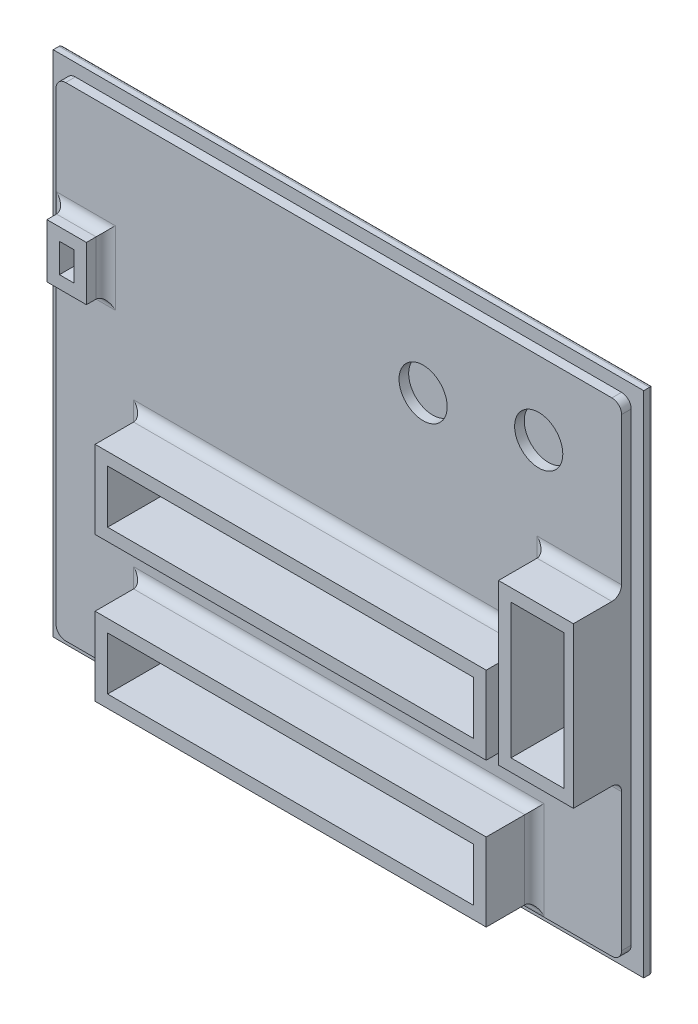
from build123d import *

# Parameters (mm, degrees)
OUTSIDE_DIM_W                         = 61.3
OUTSIDE_DIM_H                         = 52.8
DODANIE_WYCI_GNI_CIE1_DEPTH           = 1
INSIDE_DIM_W                          = 58.7
INSIDE_DIM_H                          = 50.2
DODANIE_WYCI_GNI_CIE2_DEPTH           = 1
CAPACITORS_R                          = 2.5
CAPACITORS_CUTOUT_DEPTH               = 1
RESET_BUTTON_W                        = 4.1
RESET_BUTTON_H                        = 5.6
RESET_BUTTON_SHIELD_DEPTH             = 2
RESET_BUTTON_CUTOUT_DEPTH             = 41.501635769
RESET_BUTTON_CUTOUT_DEPTH_BACK        = 41.501635769
SZKIC5_3_W                            = 1.5
SZKIC5_3_H                            = 3
SWDIO_W                               = 7.775
SWDIO_H                               = 16.6
SWDIO_SHIELD_DEPTH                    = 5
SWDIO_CUTOUT_DEPTH                    = 41.760060108
SWDIO_CUTOUT_DEPTH_BACK               = 41.760060108
SZKIC6_3_W                            = 5.5
SZKIC6_3_H                            = 14
ART_SKIN_CONNECTORS_W                 = 40.6
ART_SKIN_CONNECTORS_H                 = 8.1
ART_SKIN_CONNECTORS_W_2               = 38
ART_SKIN_CONNECTORS_H_2               = 5.5
ART_SKIN_CONNECTORS_SHIELD_DEPTH      = 5
ART_SKIN_CONNECTORS_CUTOUT_DEPTH      = 41.760060108
ART_SKIN_CONNECTORS_CUTOUT_DEPTH_BACK = 41.760060108
SZKIC7_2_W                            = 38
SZKIC7_2_H                            = 5.5
BOTTOM_OF_PRINT_CURVE_R               = 0.4
SIDE_MOUNT_SURVE_R                    = 1
CURVE_ALL_SHIELDS_R                   = 1


with BuildPart() as part:
    # Outside dim → Dodanie-wyciągnięcie1 (new body)
    with BuildSketch(Plane.XY):
        Rectangle(OUTSIDE_DIM_W, OUTSIDE_DIM_H)
    extrude(amount=-DODANIE_WYCI_GNI_CIE1_DEPTH)

    # Inside dim → Dodanie-wyciągnięcie2 (add)
    with BuildSketch(Plane.XY):
        Rectangle(INSIDE_DIM_W, INSIDE_DIM_H)
    extrude(amount=DODANIE_WYCI_GNI_CIE2_DEPTH)

    # Capacitors → Capacitors cutout (cut)
    with BuildSketch(Plane.XY.offset(1)):
        with Locations((8.75, 15.75)):
            Circle(CAPACITORS_R)
        with Locations((20.75, 17.5)):
            Circle(CAPACITORS_R)
    extrude(amount=-CAPACITORS_CUTOUT_DEPTH, mode=Mode.SUBTRACT)

    # Reset button → Reset button shield (add)
    with BuildSketch(Plane.XY.offset(1)):
        with Locations((-26.25, 11)):
            Rectangle(RESET_BUTTON_W, RESET_BUTTON_H)
    extrude(amount=RESET_BUTTON_SHIELD_DEPTH)

    # Szkic5<3> → Reset button cutout (cut, two sides: drawn at the far end of the back side and taken through both)
    with BuildSketch(Plane.XY.offset(1).offset(-RESET_BUTTON_CUTOUT_DEPTH_BACK)):
        with Locations((-26.25, 11)):
            Rectangle(SZKIC5_3_W, SZKIC5_3_H)
    extrude(amount=RESET_BUTTON_CUTOUT_DEPTH + RESET_BUTTON_CUTOUT_DEPTH_BACK, mode=Mode.SUBTRACT)

    # SWDIO → SWDIO shield (add)
    with BuildSketch(Plane.XY.offset(1)):
        with Locations((25.4625, -0.5)):
            Rectangle(SWDIO_W, SWDIO_H)
    extrude(amount=SWDIO_SHIELD_DEPTH)

    # Szkic6<3> → SWDIO cutout (cut, two sides: drawn at the far end of the back side and taken through both)
    with BuildSketch(Plane.XY.offset(1).offset(-SWDIO_CUTOUT_DEPTH_BACK)):
        with Locations((25.625, -0.5)):
            Rectangle(SZKIC6_3_W, SZKIC6_3_H)
    extrude(amount=SWDIO_CUTOUT_DEPTH + SWDIO_CUTOUT_DEPTH_BACK, mode=Mode.SUBTRACT)

    # Art skin connectors → Art skin connectors shield (add)
    # profile 1 of 2: a face of its own
    with BuildSketch(Plane.XY.offset(1)):
        with Locations((0, -19.95)):
            Rectangle(ART_SKIN_CONNECTORS_W, ART_SKIN_CONNECTORS_H)
        with Locations((0, -19.95)):
            Rectangle(ART_SKIN_CONNECTORS_W_2, ART_SKIN_CONNECTORS_H_2, mode=Mode.SUBTRACT)
    # profile 2 of 2: a face of its own
    with BuildSketch(Plane.XY.offset(1)):
        with Locations((0, -4.95)):
            Rectangle(ART_SKIN_CONNECTORS_W, ART_SKIN_CONNECTORS_H)
        with Locations((0, -4.95)):
            Rectangle(ART_SKIN_CONNECTORS_W_2, ART_SKIN_CONNECTORS_H_2, mode=Mode.SUBTRACT)
    extrude(amount=ART_SKIN_CONNECTORS_SHIELD_DEPTH)

    # Szkic7<2> → Art skin connectors cutout (cut, two sides: drawn at the far end of the back side and taken through both)
    with BuildSketch(Plane.XY.offset(1).offset(-ART_SKIN_CONNECTORS_CUTOUT_DEPTH_BACK)):
        with Locations((0, -4.95)):
            Rectangle(SZKIC7_2_W, SZKIC7_2_H)
        with Locations((0, -19.95)):
            Rectangle(SZKIC7_2_W, SZKIC7_2_H)
    extrude(amount=ART_SKIN_CONNECTORS_CUTOUT_DEPTH + ART_SKIN_CONNECTORS_CUTOUT_DEPTH_BACK, mode=Mode.SUBTRACT)

    # Bottom of print curve
    bottom_of_print_curve_edges = [part.edges().sort_by_distance(p)[0] for p in [
        (30.65, 0, -1),
        (0, -22.7, -1),
        (-19, -19.95, -1),
        (0, -17.2, -1),
        (19, -19.95, -1),
        (-19, -4.95, -1),
        (0, -7.7, -1),
        (0, -2.2, -1),
        (19, -4.95, -1),
        (0, 26.4, -1),
        (-30.65, 0, -1),
        (-27, 11, -1),
        (-26.25, 12.5, -1),
        (-25.5, 11, -1),
        (-26.25, 9.5, -1),
        (22.875, -0.5, -1),
        (25.625, -7.5, -1),
        (25.625, 6.5, -1),
        (28.375, -0.5, -1),
        (0, -26.4, -1),
    ]]
    fillet(bottom_of_print_curve_edges, radius=BOTTOM_OF_PRINT_CURVE_R)

    # Side mount surve
    side_mount_surve_edges = [part.edges().sort_by_distance(p)[0] for p in [
        (-29.35, 25.1, 0.5),
        (-29.35, -25.1, 0.5),
        (29.35, -25.1, 0.5),
        (29.35, 25.1, 0.5),
    ]]
    fillet(side_mount_surve_edges, radius=SIDE_MOUNT_SURVE_R)

    # Curve all shields
    # the kernel refuses this fillet: 1 mm, written as the material it adds along each edge
    with BuildSketch(Plane(origin=(-20.3, -24, 1), x_dir=(-1, 0, 0), z_dir=(0, 1, 0)), Plane(origin=(20.3, -0.9, 1), x_dir=(1, 0, 0), z_dir=(0, -1, 0)), Plane(origin=(-20.3, -9, 1), x_dir=(-1, 0, 0), z_dir=(0, 1, 0)), Plane(origin=(20.3, -15.9, 1), x_dir=(1, 0, 0), z_dir=(0, -1, 0))) as curve_all_shields_piece_1:
        with BuildLine():
            CenterArc((CURVE_ALL_SHIELDS_R, CURVE_ALL_SHIELDS_R), CURVE_ALL_SHIELDS_R, 180, 90)
            Line((0, CURVE_ALL_SHIELDS_R), (0, 0))
            Line((0, 0), (CURVE_ALL_SHIELDS_R, 0))
        make_face()
    extrude(amount=8.1)
    with BuildSketch(Plane(origin=(-20.3, -0.9, 1), x_dir=(0, 1, 0), z_dir=(1, 0, 0)), Plane(origin=(20.3, -9, 1), x_dir=(0, -1, 0), z_dir=(-1, 0, 0)), Plane(origin=(-20.3, -15.9, 1), x_dir=(0, 1, 0), z_dir=(1, 0, 0)), Plane(origin=(20.3, -24, 1), x_dir=(0, -1, 0), z_dir=(-1, 0, 0))) as curve_all_shields_piece_2:
        with BuildLine():
            CenterArc((CURVE_ALL_SHIELDS_R, CURVE_ALL_SHIELDS_R), CURVE_ALL_SHIELDS_R, 180, 90)
            Line((0, CURVE_ALL_SHIELDS_R), (0, 0))
            Line((0, 0), (CURVE_ALL_SHIELDS_R, 0))
        make_face()
    extrude(amount=40.6)
    with BuildSketch(Plane(origin=(-24.2, 13.8, 1), x_dir=(0, 1, 0), z_dir=(-1, 0, 0)), Plane(origin=(-28.3, 8.2, 1), x_dir=(0, -1, 0), z_dir=(1, 0, 0))) as curve_all_shields_piece_3:
        with BuildLine():
            CenterArc((CURVE_ALL_SHIELDS_R, -CURVE_ALL_SHIELDS_R), CURVE_ALL_SHIELDS_R, 90, 90)
            Line((0, -CURVE_ALL_SHIELDS_R), (0, 0))
            Line((0, 0), (CURVE_ALL_SHIELDS_R, 0))
        make_face()
    extrude(amount=4.1)
    with BuildSketch(Plane(origin=(-28.3, 13.8, 1), x_dir=(-1, 0, 0), z_dir=(0, -1, 0)), Plane(origin=(-24.2, 8.2, 1), x_dir=(1, 0, 0), z_dir=(0, 1, 0))) as curve_all_shields_piece_4:
        with BuildLine():
            CenterArc((CURVE_ALL_SHIELDS_R, -CURVE_ALL_SHIELDS_R), CURVE_ALL_SHIELDS_R, 90, 90)
            Line((0, -CURVE_ALL_SHIELDS_R), (0, 0))
            Line((0, 0), (CURVE_ALL_SHIELDS_R, 0))
        make_face()
    extrude(amount=5.6)
    with BuildSketch(Plane(origin=(21.575, -8.8, 1), x_dir=(-1, 0, 0), z_dir=(0, 1, 0))) as curve_all_shields_piece_5:
        with BuildLine():
            CenterArc((CURVE_ALL_SHIELDS_R, CURVE_ALL_SHIELDS_R), CURVE_ALL_SHIELDS_R, 180, 90)
            Line((0, CURVE_ALL_SHIELDS_R), (0, 0))
            Line((0, 0), (CURVE_ALL_SHIELDS_R, 0))
        make_face()
    extrude(amount=16.6)
    with BuildSketch(Plane(origin=(29.35, -8.8, 1), x_dir=(0, -1, 0), z_dir=(-1, 0, 0)), Plane(origin=(21.575, 7.8, 1), x_dir=(0, 1, 0), z_dir=(1, 0, 0))) as curve_all_shields_piece_6:
        with BuildLine():
            CenterArc((CURVE_ALL_SHIELDS_R, CURVE_ALL_SHIELDS_R), CURVE_ALL_SHIELDS_R, 180, 90)
            Line((0, CURVE_ALL_SHIELDS_R), (0, 0))
            Line((0, 0), (CURVE_ALL_SHIELDS_R, 0))
        make_face()
    extrude(amount=7.775)
    with BuildSketch(Plane(origin=(20.3, -24, 1), x_dir=(0, -1, 0), z_dir=(-1, 0, 0))) as curve_all_shields_piece_7a_section:
        with BuildLine():
            CenterArc((CURVE_ALL_SHIELDS_R, CURVE_ALL_SHIELDS_R), CURVE_ALL_SHIELDS_R, 180, 90)
            Line((0, CURVE_ALL_SHIELDS_R), (0, 0))
            Line((0, 0), (CURVE_ALL_SHIELDS_R, 0))
        make_face()
    curve_all_shields_piece_7a = extrude(amount=43.1, mode=Mode.PRIVATE)
    curve_all_shields_piece_7a = split(curve_all_shields_piece_7a, bisect_by=Plane(origin=(-20.3, -24.226395114, 1.226395114), z_dir=(-1, 0, 0)), keep=Keep.TOP, mode=Mode.PRIVATE)
    with BuildSketch(Plane(origin=(-20.3, -26.5, 1), x_dir=(-1, 0, 0), z_dir=(0, 1, 0))) as curve_all_shields_piece_7b_section:
        with BuildLine():
            CenterArc((CURVE_ALL_SHIELDS_R, CURVE_ALL_SHIELDS_R), CURVE_ALL_SHIELDS_R, 180, 90)
            Line((0, CURVE_ALL_SHIELDS_R), (0, 0))
            Line((0, 0), (CURVE_ALL_SHIELDS_R, 0))
        make_face()
    curve_all_shields_piece_7b = extrude(amount=10.6, mode=Mode.PRIVATE)
    curve_all_shields_piece_7b = split(curve_all_shields_piece_7b, bisect_by=Plane(origin=(-20.526395114, -25.1, 1.226395114), z_dir=(0, 1, 0)), keep=Keep.TOP, mode=Mode.PRIVATE)
    curve_all_shields_piece_7b = split(curve_all_shields_piece_7b, bisect_by=Plane(origin=(-20.526395114, -24, 1.226395114), z_dir=(0, -1, 0)), keep=Keep.TOP, mode=Mode.PRIVATE)
    curve_all_shields_piece_7 = curve_all_shields_piece_7a & curve_all_shields_piece_7b
    add(curve_all_shields_piece_7)
    with BuildSketch(Plane(origin=(-22.8, -15.9, 1), x_dir=(0, 1, 0), z_dir=(1, 0, 0))) as curve_all_shields_piece_8a_section:
        with BuildLine():
            CenterArc((CURVE_ALL_SHIELDS_R, CURVE_ALL_SHIELDS_R), CURVE_ALL_SHIELDS_R, 180, 90)
            Line((0, CURVE_ALL_SHIELDS_R), (0, 0))
            Line((0, 0), (CURVE_ALL_SHIELDS_R, 0))
        make_face()
    curve_all_shields_piece_8a = extrude(amount=43.1, mode=Mode.PRIVATE)
    curve_all_shields_piece_8a = split(curve_all_shields_piece_8a, bisect_by=Plane(origin=(-20.3, -15.673604886, 1.226395114), z_dir=(-1, 0, 0)), keep=Keep.TOP, mode=Mode.PRIVATE)
    with BuildSketch(Plane(origin=(-20.3, -24, 1), x_dir=(-1, 0, 0), z_dir=(0, 1, 0))) as curve_all_shields_piece_8b_section:
        with BuildLine():
            CenterArc((CURVE_ALL_SHIELDS_R, CURVE_ALL_SHIELDS_R), CURVE_ALL_SHIELDS_R, 180, 90)
            Line((0, CURVE_ALL_SHIELDS_R), (0, 0))
            Line((0, 0), (CURVE_ALL_SHIELDS_R, 0))
        make_face()
    curve_all_shields_piece_8b = extrude(amount=10.6, mode=Mode.PRIVATE)
    curve_all_shields_piece_8b = split(curve_all_shields_piece_8b, bisect_by=Plane(origin=(-20.526395114, -15.9, 1.226395114), z_dir=(0, 1, 0)), keep=Keep.TOP, mode=Mode.PRIVATE)
    curve_all_shields_piece_8 = curve_all_shields_piece_8a & curve_all_shields_piece_8b
    add(curve_all_shields_piece_8)
    with BuildSketch(Plane(origin=(-22.8, -0.9, 1), x_dir=(0, 1, 0), z_dir=(1, 0, 0))) as curve_all_shields_piece_9a_section:
        with BuildLine():
            CenterArc((CURVE_ALL_SHIELDS_R, CURVE_ALL_SHIELDS_R), CURVE_ALL_SHIELDS_R, 180, 90)
            Line((0, CURVE_ALL_SHIELDS_R), (0, 0))
            Line((0, 0), (CURVE_ALL_SHIELDS_R, 0))
        make_face()
    curve_all_shields_piece_9a = extrude(amount=43.1, mode=Mode.PRIVATE)
    curve_all_shields_piece_9a = split(curve_all_shields_piece_9a, bisect_by=Plane(origin=(-20.3, -0.673604886, 1.226395114), z_dir=(-1, 0, 0)), keep=Keep.TOP, mode=Mode.PRIVATE)
    with BuildSketch(Plane(origin=(-20.3, -9, 1), x_dir=(-1, 0, 0), z_dir=(0, 1, 0))) as curve_all_shields_piece_9b_section:
        with BuildLine():
            CenterArc((CURVE_ALL_SHIELDS_R, CURVE_ALL_SHIELDS_R), CURVE_ALL_SHIELDS_R, 180, 90)
            Line((0, CURVE_ALL_SHIELDS_R), (0, 0))
            Line((0, 0), (CURVE_ALL_SHIELDS_R, 0))
        make_face()
    curve_all_shields_piece_9b = extrude(amount=10.6, mode=Mode.PRIVATE)
    curve_all_shields_piece_9b = split(curve_all_shields_piece_9b, bisect_by=Plane(origin=(-20.526395114, -0.9, 1.226395114), z_dir=(0, 1, 0)), keep=Keep.TOP, mode=Mode.PRIVATE)
    curve_all_shields_piece_9 = curve_all_shields_piece_9a & curve_all_shields_piece_9b
    add(curve_all_shields_piece_9)
    with BuildSketch(Plane(origin=(-20.3, -0.9, 1), x_dir=(0, 1, 0), z_dir=(1, 0, 0))) as curve_all_shields_piece_10a_section:
        with BuildLine():
            CenterArc((CURVE_ALL_SHIELDS_R, CURVE_ALL_SHIELDS_R), CURVE_ALL_SHIELDS_R, 180, 90)
            Line((0, CURVE_ALL_SHIELDS_R), (0, 0))
            Line((0, 0), (CURVE_ALL_SHIELDS_R, 0))
        make_face()
    curve_all_shields_piece_10a = extrude(amount=43.1, mode=Mode.PRIVATE)
    curve_all_shields_piece_10a = split(curve_all_shields_piece_10a, bisect_by=Plane(origin=(20.3, -0.673604886, 1.226395114), z_dir=(1, 0, 0)), keep=Keep.TOP, mode=Mode.PRIVATE)
    with BuildSketch(Plane(origin=(20.3, 1.6, 1), x_dir=(1, 0, 0), z_dir=(0, -1, 0))) as curve_all_shields_piece_10b_section:
        with BuildLine():
            CenterArc((CURVE_ALL_SHIELDS_R, CURVE_ALL_SHIELDS_R), CURVE_ALL_SHIELDS_R, 180, 90)
            Line((0, CURVE_ALL_SHIELDS_R), (0, 0))
            Line((0, 0), (CURVE_ALL_SHIELDS_R, 0))
        make_face()
    curve_all_shields_piece_10b = extrude(amount=10.6, mode=Mode.PRIVATE)
    curve_all_shields_piece_10b = split(curve_all_shields_piece_10b, bisect_by=Plane(origin=(20.526395114, -0.9, 1.226395114), z_dir=(0, 1, 0)), keep=Keep.TOP, mode=Mode.PRIVATE)
    curve_all_shields_piece_10 = curve_all_shields_piece_10a & curve_all_shields_piece_10b
    add(curve_all_shields_piece_10)
    with BuildSketch(Plane(origin=(20.3, -0.9, 1), x_dir=(1, 0, 0), z_dir=(0, -1, 0))) as curve_all_shields_piece_11a_section:
        with BuildLine():
            CenterArc((CURVE_ALL_SHIELDS_R, CURVE_ALL_SHIELDS_R), CURVE_ALL_SHIELDS_R, 180, 90)
            Line((0, CURVE_ALL_SHIELDS_R), (0, 0))
            Line((0, 0), (CURVE_ALL_SHIELDS_R, 0))
        make_face()
    curve_all_shields_piece_11a = extrude(amount=10.6, mode=Mode.PRIVATE)
    curve_all_shields_piece_11a = split(curve_all_shields_piece_11a, bisect_by=Plane(origin=(20.526395114, -9, 1.226395114), z_dir=(0, -1, 0)), keep=Keep.TOP, mode=Mode.PRIVATE)
    with BuildSketch(Plane(origin=(22.8, -9, 1), x_dir=(0, -1, 0), z_dir=(-1, 0, 0))) as curve_all_shields_piece_11b_section:
        with BuildLine():
            CenterArc((CURVE_ALL_SHIELDS_R, CURVE_ALL_SHIELDS_R), CURVE_ALL_SHIELDS_R, 180, 90)
            Line((0, CURVE_ALL_SHIELDS_R), (0, 0))
            Line((0, 0), (CURVE_ALL_SHIELDS_R, 0))
        make_face()
    curve_all_shields_piece_11b = extrude(amount=43.1, mode=Mode.PRIVATE)
    curve_all_shields_piece_11b = split(curve_all_shields_piece_11b, bisect_by=Plane(origin=(20.3, -9.226395114, 1.226395114), z_dir=(1, 0, 0)), keep=Keep.TOP, mode=Mode.PRIVATE)
    curve_all_shields_piece_11 = curve_all_shields_piece_11a & curve_all_shields_piece_11b
    add(curve_all_shields_piece_11)
    with BuildSketch(Plane(origin=(20.3, -9, 1), x_dir=(0, -1, 0), z_dir=(-1, 0, 0))) as curve_all_shields_piece_12a_section:
        with BuildLine():
            CenterArc((CURVE_ALL_SHIELDS_R, CURVE_ALL_SHIELDS_R), CURVE_ALL_SHIELDS_R, 180, 90)
            Line((0, CURVE_ALL_SHIELDS_R), (0, 0))
            Line((0, 0), (CURVE_ALL_SHIELDS_R, 0))
        make_face()
    curve_all_shields_piece_12a = extrude(amount=43.1, mode=Mode.PRIVATE)
    curve_all_shields_piece_12a = split(curve_all_shields_piece_12a, bisect_by=Plane(origin=(-20.3, -9.226395114, 1.226395114), z_dir=(-1, 0, 0)), keep=Keep.TOP, mode=Mode.PRIVATE)
    with BuildSketch(Plane(origin=(-20.3, -11.5, 1), x_dir=(-1, 0, 0), z_dir=(0, 1, 0))) as curve_all_shields_piece_12b_section:
        with BuildLine():
            CenterArc((CURVE_ALL_SHIELDS_R, CURVE_ALL_SHIELDS_R), CURVE_ALL_SHIELDS_R, 180, 90)
            Line((0, CURVE_ALL_SHIELDS_R), (0, 0))
            Line((0, 0), (CURVE_ALL_SHIELDS_R, 0))
        make_face()
    curve_all_shields_piece_12b = extrude(amount=10.6, mode=Mode.PRIVATE)
    curve_all_shields_piece_12b = split(curve_all_shields_piece_12b, bisect_by=Plane(origin=(-20.526395114, -9, 1.226395114), z_dir=(0, -1, 0)), keep=Keep.TOP, mode=Mode.PRIVATE)
    curve_all_shields_piece_12 = curve_all_shields_piece_12a & curve_all_shields_piece_12b
    add(curve_all_shields_piece_12)
    with BuildSketch(Plane(origin=(-24.2, 8.2, 1), x_dir=(1, 0, 0), z_dir=(0, 1, 0))) as curve_all_shields_piece_13a_section:
        with BuildLine():
            CenterArc((CURVE_ALL_SHIELDS_R, -CURVE_ALL_SHIELDS_R), CURVE_ALL_SHIELDS_R, 90, 90)
            Line((0, -CURVE_ALL_SHIELDS_R), (0, 0))
            Line((0, 0), (CURVE_ALL_SHIELDS_R, 0))
        make_face()
    curve_all_shields_piece_13a = extrude(amount=8.1, mode=Mode.PRIVATE)
    curve_all_shields_piece_13a = split(curve_all_shields_piece_13a, bisect_by=Plane(origin=(-23.973604886, 13.8, 1.226395114), z_dir=(0, 1, 0)), keep=Keep.TOP, mode=Mode.PRIVATE)
    with BuildSketch(Plane(origin=(-21.7, 13.8, 1), x_dir=(0, 1, 0), z_dir=(-1, 0, 0))) as curve_all_shields_piece_13b_section:
        with BuildLine():
            CenterArc((CURVE_ALL_SHIELDS_R, -CURVE_ALL_SHIELDS_R), CURVE_ALL_SHIELDS_R, 90, 90)
            Line((0, -CURVE_ALL_SHIELDS_R), (0, 0))
            Line((0, 0), (CURVE_ALL_SHIELDS_R, 0))
        make_face()
    curve_all_shields_piece_13b = extrude(amount=6.6, mode=Mode.PRIVATE)
    curve_all_shields_piece_13b = split(curve_all_shields_piece_13b, bisect_by=Plane(origin=(-24.2, 14.026395114, 1.226395114), z_dir=(1, 0, 0)), keep=Keep.TOP, mode=Mode.PRIVATE)
    curve_all_shields_piece_13 = curve_all_shields_piece_13a & curve_all_shields_piece_13b
    add(curve_all_shields_piece_13)
    with BuildSketch(Plane(origin=(-24.2, 13.8, 1), x_dir=(0, 1, 0), z_dir=(-1, 0, 0))) as curve_all_shields_piece_14a_section:
        with BuildLine():
            CenterArc((CURVE_ALL_SHIELDS_R, -CURVE_ALL_SHIELDS_R), CURVE_ALL_SHIELDS_R, 90, 90)
            Line((0, -CURVE_ALL_SHIELDS_R), (0, 0))
            Line((0, 0), (CURVE_ALL_SHIELDS_R, 0))
        make_face()
    curve_all_shields_piece_14a = extrude(amount=6.6, mode=Mode.PRIVATE)
    curve_all_shields_piece_14a = split(curve_all_shields_piece_14a, bisect_by=Plane(origin=(-29.35, 14.026395114, 1.226395114), z_dir=(1, 0, 0)), keep=Keep.TOP, mode=Mode.PRIVATE)
    curve_all_shields_piece_14a = split(curve_all_shields_piece_14a, bisect_by=Plane(origin=(-28.3, 14.026395114, 1.226395114), z_dir=(-1, 0, 0)), keep=Keep.TOP, mode=Mode.PRIVATE)
    with BuildSketch(Plane(origin=(-28.3, 16.3, 1), x_dir=(-1, 0, 0), z_dir=(0, -1, 0))) as curve_all_shields_piece_14b_section:
        with BuildLine():
            CenterArc((CURVE_ALL_SHIELDS_R, -CURVE_ALL_SHIELDS_R), CURVE_ALL_SHIELDS_R, 90, 90)
            Line((0, -CURVE_ALL_SHIELDS_R), (0, 0))
            Line((0, 0), (CURVE_ALL_SHIELDS_R, 0))
        make_face()
    curve_all_shields_piece_14b = extrude(amount=8.1, mode=Mode.PRIVATE)
    curve_all_shields_piece_14b = split(curve_all_shields_piece_14b, bisect_by=Plane(origin=(-28.526395114, 13.8, 1.226395114), z_dir=(0, 1, 0)), keep=Keep.TOP, mode=Mode.PRIVATE)
    curve_all_shields_piece_14 = curve_all_shields_piece_14a & curve_all_shields_piece_14b
    add(curve_all_shields_piece_14)
    with BuildSketch(Plane(origin=(-30.8, 8.2, 1), x_dir=(0, -1, 0), z_dir=(1, 0, 0))) as curve_all_shields_piece_15a_section:
        with BuildLine():
            CenterArc((CURVE_ALL_SHIELDS_R, -CURVE_ALL_SHIELDS_R), CURVE_ALL_SHIELDS_R, 90, 90)
            Line((0, -CURVE_ALL_SHIELDS_R), (0, 0))
            Line((0, 0), (CURVE_ALL_SHIELDS_R, 0))
        make_face()
    curve_all_shields_piece_15a = extrude(amount=6.6, mode=Mode.PRIVATE)
    curve_all_shields_piece_15a = split(curve_all_shields_piece_15a, bisect_by=Plane(origin=(-29.35, 7.973604886, 1.226395114), z_dir=(1, 0, 0)), keep=Keep.TOP, mode=Mode.PRIVATE)
    curve_all_shields_piece_15a = split(curve_all_shields_piece_15a, bisect_by=Plane(origin=(-28.3, 7.973604886, 1.226395114), z_dir=(-1, 0, 0)), keep=Keep.TOP, mode=Mode.PRIVATE)
    with BuildSketch(Plane(origin=(-28.3, 13.8, 1), x_dir=(-1, 0, 0), z_dir=(0, -1, 0))) as curve_all_shields_piece_15b_section:
        with BuildLine():
            CenterArc((CURVE_ALL_SHIELDS_R, -CURVE_ALL_SHIELDS_R), CURVE_ALL_SHIELDS_R, 90, 90)
            Line((0, -CURVE_ALL_SHIELDS_R), (0, 0))
            Line((0, 0), (CURVE_ALL_SHIELDS_R, 0))
        make_face()
    curve_all_shields_piece_15b = extrude(amount=8.1, mode=Mode.PRIVATE)
    curve_all_shields_piece_15b = split(curve_all_shields_piece_15b, bisect_by=Plane(origin=(-28.526395114, 8.2, 1.226395114), z_dir=(0, -1, 0)), keep=Keep.TOP, mode=Mode.PRIVATE)
    curve_all_shields_piece_15 = curve_all_shields_piece_15a & curve_all_shields_piece_15b
    add(curve_all_shields_piece_15)
    with BuildSketch(Plane(origin=(-24.2, 5.7, 1), x_dir=(1, 0, 0), z_dir=(0, 1, 0))) as curve_all_shields_piece_16a_section:
        with BuildLine():
            CenterArc((CURVE_ALL_SHIELDS_R, -CURVE_ALL_SHIELDS_R), CURVE_ALL_SHIELDS_R, 90, 90)
            Line((0, -CURVE_ALL_SHIELDS_R), (0, 0))
            Line((0, 0), (CURVE_ALL_SHIELDS_R, 0))
        make_face()
    curve_all_shields_piece_16a = extrude(amount=8.1, mode=Mode.PRIVATE)
    curve_all_shields_piece_16a = split(curve_all_shields_piece_16a, bisect_by=Plane(origin=(-23.973604886, 8.2, 1.226395114), z_dir=(0, -1, 0)), keep=Keep.TOP, mode=Mode.PRIVATE)
    with BuildSketch(Plane(origin=(-28.3, 8.2, 1), x_dir=(0, -1, 0), z_dir=(1, 0, 0))) as curve_all_shields_piece_16b_section:
        with BuildLine():
            CenterArc((CURVE_ALL_SHIELDS_R, -CURVE_ALL_SHIELDS_R), CURVE_ALL_SHIELDS_R, 90, 90)
            Line((0, -CURVE_ALL_SHIELDS_R), (0, 0))
            Line((0, 0), (CURVE_ALL_SHIELDS_R, 0))
        make_face()
    curve_all_shields_piece_16b = extrude(amount=6.6, mode=Mode.PRIVATE)
    curve_all_shields_piece_16b = split(curve_all_shields_piece_16b, bisect_by=Plane(origin=(-24.2, 7.973604886, 1.226395114), z_dir=(1, 0, 0)), keep=Keep.TOP, mode=Mode.PRIVATE)
    curve_all_shields_piece_16 = curve_all_shields_piece_16a & curve_all_shields_piece_16b
    add(curve_all_shields_piece_16)
    with BuildSketch(Plane(origin=(29.35, -8.8, 1), x_dir=(0, -1, 0), z_dir=(-1, 0, 0))) as curve_all_shields_piece_17a_section:
        with BuildLine():
            CenterArc((CURVE_ALL_SHIELDS_R, CURVE_ALL_SHIELDS_R), CURVE_ALL_SHIELDS_R, 180, 90)
            Line((0, CURVE_ALL_SHIELDS_R), (0, 0))
            Line((0, 0), (CURVE_ALL_SHIELDS_R, 0))
        make_face()
    curve_all_shields_piece_17a = extrude(amount=10.275, mode=Mode.PRIVATE)
    curve_all_shields_piece_17a = split(curve_all_shields_piece_17a, bisect_by=Plane(origin=(21.575, -9.026395114, 1.226395114), z_dir=(-1, 0, 0)), keep=Keep.TOP, mode=Mode.PRIVATE)
    with BuildSketch(Plane(origin=(21.575, -11.3, 1), x_dir=(-1, 0, 0), z_dir=(0, 1, 0))) as curve_all_shields_piece_17b_section:
        with BuildLine():
            CenterArc((CURVE_ALL_SHIELDS_R, CURVE_ALL_SHIELDS_R), CURVE_ALL_SHIELDS_R, 180, 90)
            Line((0, CURVE_ALL_SHIELDS_R), (0, 0))
            Line((0, 0), (CURVE_ALL_SHIELDS_R, 0))
        make_face()
    curve_all_shields_piece_17b = extrude(amount=19.1, mode=Mode.PRIVATE)
    curve_all_shields_piece_17b = split(curve_all_shields_piece_17b, bisect_by=Plane(origin=(21.348604886, -8.8, 1.226395114), z_dir=(0, -1, 0)), keep=Keep.TOP, mode=Mode.PRIVATE)
    curve_all_shields_piece_17 = curve_all_shields_piece_17a & curve_all_shields_piece_17b
    add(curve_all_shields_piece_17)
    with BuildSketch(Plane(origin=(19.075, 7.8, 1), x_dir=(0, 1, 0), z_dir=(1, 0, 0))) as curve_all_shields_piece_18a_section:
        with BuildLine():
            CenterArc((CURVE_ALL_SHIELDS_R, CURVE_ALL_SHIELDS_R), CURVE_ALL_SHIELDS_R, 180, 90)
            Line((0, CURVE_ALL_SHIELDS_R), (0, 0))
            Line((0, 0), (CURVE_ALL_SHIELDS_R, 0))
        make_face()
    curve_all_shields_piece_18a = extrude(amount=10.275, mode=Mode.PRIVATE)
    curve_all_shields_piece_18a = split(curve_all_shields_piece_18a, bisect_by=Plane(origin=(21.575, 8.026395114, 1.226395114), z_dir=(-1, 0, 0)), keep=Keep.TOP, mode=Mode.PRIVATE)
    with BuildSketch(Plane(origin=(21.575, -8.8, 1), x_dir=(-1, 0, 0), z_dir=(0, 1, 0))) as curve_all_shields_piece_18b_section:
        with BuildLine():
            CenterArc((CURVE_ALL_SHIELDS_R, CURVE_ALL_SHIELDS_R), CURVE_ALL_SHIELDS_R, 180, 90)
            Line((0, CURVE_ALL_SHIELDS_R), (0, 0))
            Line((0, 0), (CURVE_ALL_SHIELDS_R, 0))
        make_face()
    curve_all_shields_piece_18b = extrude(amount=19.1, mode=Mode.PRIVATE)
    curve_all_shields_piece_18b = split(curve_all_shields_piece_18b, bisect_by=Plane(origin=(21.348604886, 7.8, 1.226395114), z_dir=(0, 1, 0)), keep=Keep.TOP, mode=Mode.PRIVATE)
    curve_all_shields_piece_18 = curve_all_shields_piece_18a & curve_all_shields_piece_18b
    add(curve_all_shields_piece_18)
    with BuildSketch(Plane(origin=(-20.3, -15.9, 1), x_dir=(0, 1, 0), z_dir=(1, 0, 0))) as curve_all_shields_piece_19a_section:
        with BuildLine():
            CenterArc((CURVE_ALL_SHIELDS_R, CURVE_ALL_SHIELDS_R), CURVE_ALL_SHIELDS_R, 180, 90)
            Line((0, CURVE_ALL_SHIELDS_R), (0, 0))
            Line((0, 0), (CURVE_ALL_SHIELDS_R, 0))
        make_face()
    curve_all_shields_piece_19a = extrude(amount=43.1, mode=Mode.PRIVATE)
    curve_all_shields_piece_19a = split(curve_all_shields_piece_19a, bisect_by=Plane(origin=(20.3, -15.673604886, 1.226395114), z_dir=(1, 0, 0)), keep=Keep.TOP, mode=Mode.PRIVATE)
    with BuildSketch(Plane(origin=(20.3, -13.4, 1), x_dir=(1, 0, 0), z_dir=(0, -1, 0))) as curve_all_shields_piece_19b_section:
        with BuildLine():
            CenterArc((CURVE_ALL_SHIELDS_R, CURVE_ALL_SHIELDS_R), CURVE_ALL_SHIELDS_R, 180, 90)
            Line((0, CURVE_ALL_SHIELDS_R), (0, 0))
            Line((0, 0), (CURVE_ALL_SHIELDS_R, 0))
        make_face()
    curve_all_shields_piece_19b = extrude(amount=10.6, mode=Mode.PRIVATE)
    curve_all_shields_piece_19b = split(curve_all_shields_piece_19b, bisect_by=Plane(origin=(20.526395114, -15.9, 1.226395114), z_dir=(0, 1, 0)), keep=Keep.TOP, mode=Mode.PRIVATE)
    curve_all_shields_piece_19 = curve_all_shields_piece_19a & curve_all_shields_piece_19b
    add(curve_all_shields_piece_19)
    with BuildSketch(Plane(origin=(20.3, -15.9, 1), x_dir=(1, 0, 0), z_dir=(0, -1, 0))) as curve_all_shields_piece_20a_section:
        with BuildLine():
            CenterArc((CURVE_ALL_SHIELDS_R, CURVE_ALL_SHIELDS_R), CURVE_ALL_SHIELDS_R, 180, 90)
            Line((0, CURVE_ALL_SHIELDS_R), (0, 0))
            Line((0, 0), (CURVE_ALL_SHIELDS_R, 0))
        make_face()
    curve_all_shields_piece_20a = extrude(amount=10.6, mode=Mode.PRIVATE)
    curve_all_shields_piece_20a = split(curve_all_shields_piece_20a, bisect_by=Plane(origin=(20.526395114, -25.1, 1.226395114), z_dir=(0, 1, 0)), keep=Keep.TOP, mode=Mode.PRIVATE)
    curve_all_shields_piece_20a = split(curve_all_shields_piece_20a, bisect_by=Plane(origin=(20.526395114, -24, 1.226395114), z_dir=(0, -1, 0)), keep=Keep.TOP, mode=Mode.PRIVATE)
    with BuildSketch(Plane(origin=(22.8, -24, 1), x_dir=(0, -1, 0), z_dir=(-1, 0, 0))) as curve_all_shields_piece_20b_section:
        with BuildLine():
            CenterArc((CURVE_ALL_SHIELDS_R, CURVE_ALL_SHIELDS_R), CURVE_ALL_SHIELDS_R, 180, 90)
            Line((0, CURVE_ALL_SHIELDS_R), (0, 0))
            Line((0, 0), (CURVE_ALL_SHIELDS_R, 0))
        make_face()
    curve_all_shields_piece_20b = extrude(amount=43.1, mode=Mode.PRIVATE)
    curve_all_shields_piece_20b = split(curve_all_shields_piece_20b, bisect_by=Plane(origin=(20.3, -24.226395114, 1.226395114), z_dir=(1, 0, 0)), keep=Keep.TOP, mode=Mode.PRIVATE)
    curve_all_shields_piece_20 = curve_all_shields_piece_20a & curve_all_shields_piece_20b
    add(curve_all_shields_piece_20)


solid = part.part
